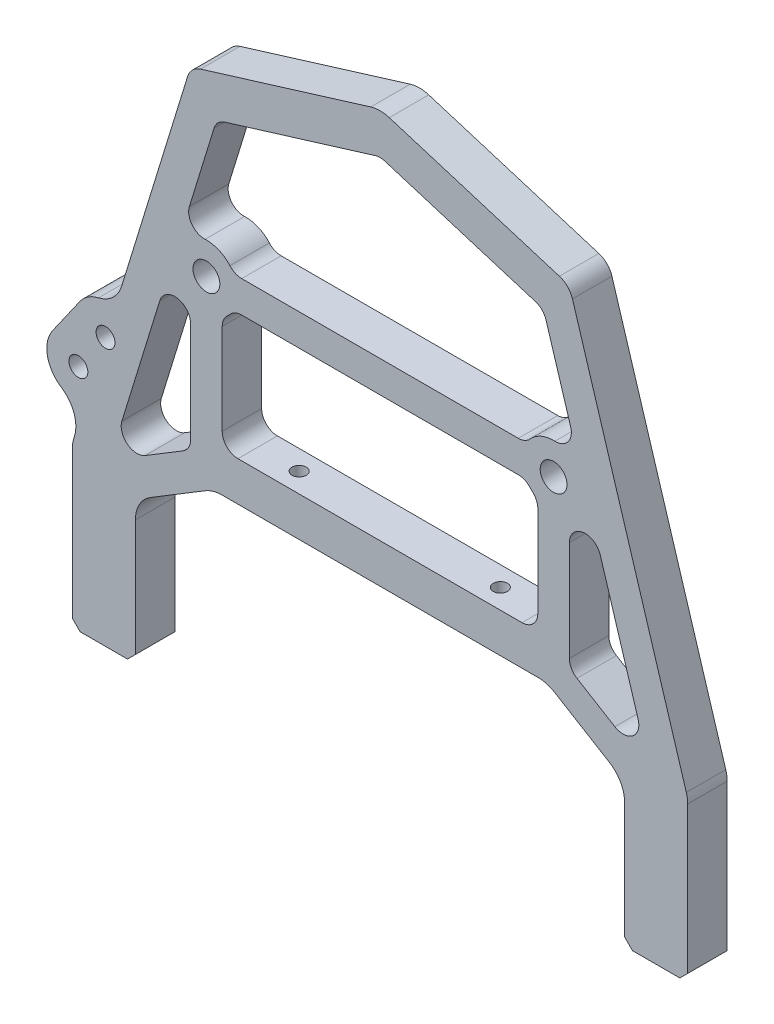
from build123d import *

# Parameters (mm, degrees)
BOSS_EXTRUDE3_DEPTH              = 2.5
FILLET3_R                        = 2
CUT_EXTRUDE1_DEPTH               = 86.90473786
FILLET1_R                        = 2
FILLET2_R                        = 4
M3_CLEARANCE_HOLE1_D             = 3.4
M3X0_5_TAPPED_HOLE1_D            = 2.5
M3X0_5_TAPPED_HOLE1_DEPTH        = 7.5
M3X0_5_TAPPED_HOLE1_TIP          = 0.751075774
CHAMFER1_SIZE                    = 1
CBORE_FOR_M1_6_SHCS1_D           = 1.8
CBORE_FOR_M1_6_SHCS1_DEPTH       = 5
CBORE_FOR_M1_6_SHCS1_CBORE_D     = 3.5
CBORE_FOR_M1_6_SHCS1_CBORE_DEPTH = 1.6
BOSS_EXTRUDE4_DEPTH              = 5
FILLET4_R                        = 4
M2_CLEARANCE_HOLE1_D             = 2.4
M2_CLEARANCE_HOLE1_DEPTH         = 7.5
M2_CLEARANCE_HOLE1_TIP           = 0.721032743


with BuildPart() as part:
    # Sketch1 → Boss-Extrude3 (new, symmetric)
    with BuildSketch(Plane.XY):
        with BuildLine():
            Line((-39, 0), (-31, 0))
            Line((-31, 0), (-31, 18.037654982))
            Line((-31, 18.037654982), (-21.161883591, 24))
            Line((-21.161883591, 24), (21.161883591, 24))
            Line((21.161883591, 24), (31, 18.037654982))
            Line((31, 18.037654982), (31, 0))
            Line((31, 0), (39, 0))
            Line((39, 0), (39, 20.205165085))
            Line((39, 20.205165085), (24.389646385, 67.734568005))
            ThreePointArc((24.389646385, 67.734568005), (23.767766953, 68.767766953), (22.734568005, 69.389646385))
            Line((22.734568005, 69.389646385), (0, 76.378164175))
            Line((0, 76.378164175), (-22.734568005, 69.389646385))
            ThreePointArc((-22.734568005, 69.389646385), (-23.767766953, 68.767766953), (-24.389646385, 67.734568005))
            Line((-24.389646385, 67.734568005), (-39, 20.205165085))
            Line((-39, 20.205165085), (-39, 0))
        make_face()
        with BuildLine():
            Line((-20, 29), (-20, 43.535898385))
            ThreePointArc((-20, 43.535898385), (-19.171572875, 44.171572875), (-18.535898385, 45))
            Line((-18.535898385, 45), (18.535898385, 45))
            ThreePointArc((18.535898385, 45), (19.171572875, 44.171572875), (20, 43.535898385))
            Line((20, 43.535898385), (20, 29))
            Line((20, 29), (-20, 29))
        make_face(mode=Mode.SUBTRACT)
        with BuildLine():
            Line((18.535898385, 49), (-18.535898385, 49))
            ThreePointArc((-18.535898385, 49), (-22.449787583, 50.974630943), (-25.823434216, 48.175308809))
            Line((-25.823434216, 48.175308809), (-20.719808061, 64.77807629))
            Line((-20.719808061, 64.77807629), (0, 71.147264708))
            Line((0, 71.147264708), (20.719808061, 64.77807629))
            Line((20.719808061, 64.77807629), (25.823434216, 48.175308809))
            ThreePointArc((25.823434216, 48.175308809), (22.449787583, 50.974630943), (18.535898385, 49))
        make_face(mode=Mode.SUBTRACT)
    extrude(amount=BOSS_EXTRUDE3_DEPTH, both=True)

    # Fillet3
    fillet3_edges = [part.edges().sort_by_distance(p)[0] for p in [
        (-18.535898385, 45, 0),
        (-20, 43.535898385, 0),
        (-20, 29, 0),
        (20, 29, 0),
        (20, 43.535898385, 0),
        (18.535898385, 45, 0),
        (20.719808061, 64.77807629, 0),
        (0, 71.147264708, 0),
        (-20.719808061, 64.77807629, 0),
        (-25.823434216, 48.175308809, 0),
        (-18.535898385, 49, 0),
        (18.535898385, 49, 0),
    ]]
    fillet(fillet3_edges, radius=FILLET3_R - 0.0004)  # a hair under: the kernel refuses the full size
    fillet3_2_edges = [part.edges().sort_by_distance(p)[0] for p in [
        (25.823434216, 48.175308809, 0),
    ]]
    fillet(fillet3_2_edges, radius=FILLET3_R)

    # Sketch2 → Cut-Extrude1 (cut, through all)
    with BuildSketch(Plane(origin=(0, 0, -2.5), x_dir=(-1, 0, 0), z_dir=(0, 0, -1))):
        with BuildLine():
            Line((-27.911717108, 41.381849759), (-34.256545, 20.741289696))
            Line((-34.256545, 20.741289696), (-24, 26.957221429))
            Line((-24, 26.957221429), (-24, 40.794195355))
            ThreePointArc((-24, 40.794195355), (-25.702875629, 42.77200149), (-27.911717108, 41.381849759))
        make_face()
        with BuildLine():
            Line((24, 26.957221429), (34.256545, 20.741289696))
            Line((34.256545, 20.741289696), (27.911717108, 41.381849759))
            ThreePointArc((27.911717108, 41.381849759), (25.702875629, 42.77200149), (24, 40.794195355))
            Line((24, 40.794195355), (24, 26.957221429))
        make_face()
    extrude(amount=-CUT_EXTRUDE1_DEPTH, mode=Mode.SUBTRACT)

    # Fillet1
    fillet1_edges = [part.edges().sort_by_distance(p)[0] for p in [
        (24, 26.957221429, 0),
        (34.256545, 20.741289696, 0),
        (-34.256545, 20.741289696, 0),
        (-24, 26.957221429, 0),
    ]]
    fillet(fillet1_edges, radius=FILLET1_R)

    # Fillet2
    fillet2_edges = [part.edges().sort_by_distance(p)[0] for p in [
        (39, 20.205165085, 0),
        (31, 18.037654982, 0),
        (21.161883591, 24, 0),
        (-21.161883591, 24, 0),
        (-31, 18.037654982, 0),
        (-39, 20.205165085, 0),
        (0, 76.378164175, 0),
    ]]
    fillet(fillet2_edges, radius=FILLET2_R)

    # M3 Clearance Hole1 (through all)
    with Locations(Plane.XY.offset(2.5)):
        with Locations((-22, 47), (22, 47)):
            Hole(M3_CLEARANCE_HOLE1_D / 2)

    # M3x0.5 Tapped Hole1
    with Locations(Plane(origin=(0, 0, 0), x_dir=(-1, 0, 0), z_dir=(0, -1, 0))):
        with Locations((-35, 0), (35, 0)):
            Hole(M3X0_5_TAPPED_HOLE1_D / 2, depth=M3X0_5_TAPPED_HOLE1_DEPTH)
            with Locations((0, 0, -(M3X0_5_TAPPED_HOLE1_DEPTH + M3X0_5_TAPPED_HOLE1_TIP / 2))):  # 118° drill point
                Cone(0, M3X0_5_TAPPED_HOLE1_D / 2, M3X0_5_TAPPED_HOLE1_TIP, mode=Mode.SUBTRACT)

    # Chamfer1
    chamfer1_edges = [part.edges().sort_by_distance(p)[0] for p in [
        (39, 0, 0),
        (31, 0, 0),
        (-31, 0, 0),
        (-39, 0, 0),
    ]]
    chamfer(chamfer1_edges, length=CHAMFER1_SIZE)

    # CBORE for M1.6 SHCS1
    with Locations(Plane(origin=(0, 24, 0), x_dir=(-1, 0, 0), z_dir=(0, -1, 0))):
        with Locations((12.75, 0), (-12.75, 0)):
            CounterBoreHole(CBORE_FOR_M1_6_SHCS1_D / 2, CBORE_FOR_M1_6_SHCS1_CBORE_D / 2, CBORE_FOR_M1_6_SHCS1_CBORE_DEPTH, depth=CBORE_FOR_M1_6_SHCS1_DEPTH)

    # Sketch12 → Boss-Extrude4 (add)
    with BuildSketch(Plane.XY.offset(2.5)):
        with BuildLine():
            Line((-41.503743829, 31.294305745), (-38.062285211, 36.209218011))
            ThreePointArc((-38.062285211, 36.209218011), (-32.491371289, 37.191520443), (-31.509068857, 31.62060652))
            Line((-31.509068857, 31.62060652), (-34.950527475, 26.705694255))
            ThreePointArc((-34.950527475, 26.705694255), (-40.521441398, 25.723391823), (-41.503743829, 31.294305745))
        make_face()
    extrude(amount=-BOSS_EXTRUDE4_DEPTH)

    # Fillet4
    fillet4_edges = [part.edges().sort_by_distance(p)[0] for p in [
        (-33.610368225, 37.738346482, 0),
        (-37.505935548, 25.065553354, 0),
    ]]
    fillet(fillet4_edges, radius=FILLET4_R)

    # M2 Clearance Hole1
    with Locations(Plane.XY.offset(2.5)):
        with Locations((-38.227135652, 29), (-34.785677034, 33.914912266)):
            Hole(M2_CLEARANCE_HOLE1_D / 2, depth=M2_CLEARANCE_HOLE1_DEPTH)
            with Locations((0, 0, -(M2_CLEARANCE_HOLE1_DEPTH + M2_CLEARANCE_HOLE1_TIP / 2))):  # 118° drill point
                Cone(0, M2_CLEARANCE_HOLE1_D / 2, M2_CLEARANCE_HOLE1_TIP, mode=Mode.SUBTRACT)


solid = part.part
